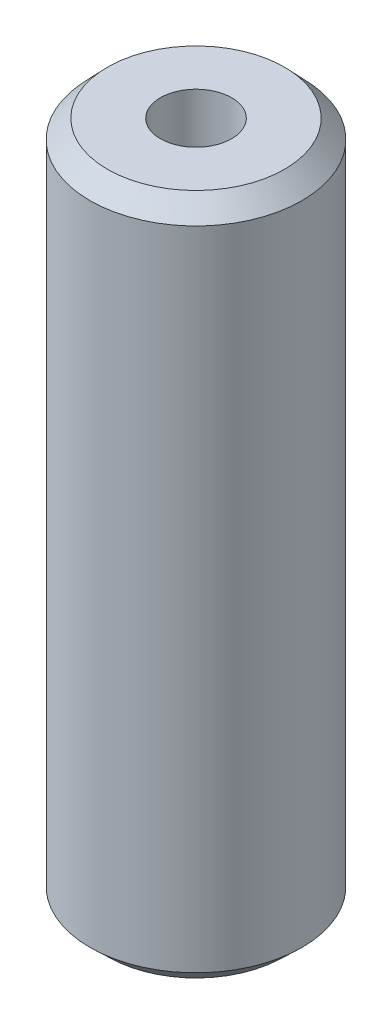
from build123d import *
from OCP.BRepFilletAPI import BRepFilletAPI_MakeChamfer

# Parameters (mm, degrees)
SKETCH1_R           = 12.5
BOSS_EXTRUDE1_DEPTH = 80.484447984
SKETCH2_R           = 4.196464607
CUT_EXTRUDE1_DEPTH  = 83.402951205
CHAMFER1_SIZE       = 2.167274696
CHAMFER1_SIZE2      = 2.062026411


with BuildPart() as part:
    # Sketch1 → Boss-Extrude1 (new body)
    with BuildSketch(Plane(origin=(0, 0, 0), x_dir=(1, 0, 0), z_dir=(0, 1, 0))):
        Circle(SKETCH1_R)
    extrude(amount=BOSS_EXTRUDE1_DEPTH)

    # Sketch2 → Cut-Extrude1 (cut, through all)
    with BuildSketch(Plane(origin=(0, 0, 0), x_dir=(1, 0, 0), z_dir=(0, 1, 0))):
        Circle(SKETCH2_R)
    extrude(amount=CUT_EXTRUDE1_DEPTH, mode=Mode.SUBTRACT)

    # Chamfer1: one chamfer whose edges measure the first distance from different faces: ONE call of the kernel's chamfer builder (chamfer() names one face for all edges)
    chamfer1_edges_1 = [part.edges().sort_by_distance(p)[0] for p in [
        (-12.5, 80.484447984, 0),
    ]]
    chamfer1_side_1 = [part.faces().sort_by_distance(p)[0] for p in [
        (-12.5, 40.242223992, 0),
    ]]
    chamfer1_edges_2 = [part.edges().sort_by_distance(p)[0] for p in [
        (-12.5, 0, 0),
    ]]
    chamfer1_side_2 = [part.faces().sort_by_distance(p)[0] for p in [
        (-12.146446609, 0, 0),
    ]]
    chamfer1 = BRepFilletAPI_MakeChamfer(part.part.solid().wrapped)
    for e in chamfer1_edges_1:
        chamfer1.Add(CHAMFER1_SIZE, CHAMFER1_SIZE2, e.wrapped, chamfer1_side_1[0].wrapped)  # the first distance lies on this face
    for e in chamfer1_edges_2:
        chamfer1.Add(CHAMFER1_SIZE, CHAMFER1_SIZE2, e.wrapped, chamfer1_side_2[0].wrapped)  # the first distance lies on this face
    add(Compound.cast(chamfer1.Shape()), mode=Mode.REPLACE)


solid = part.part
